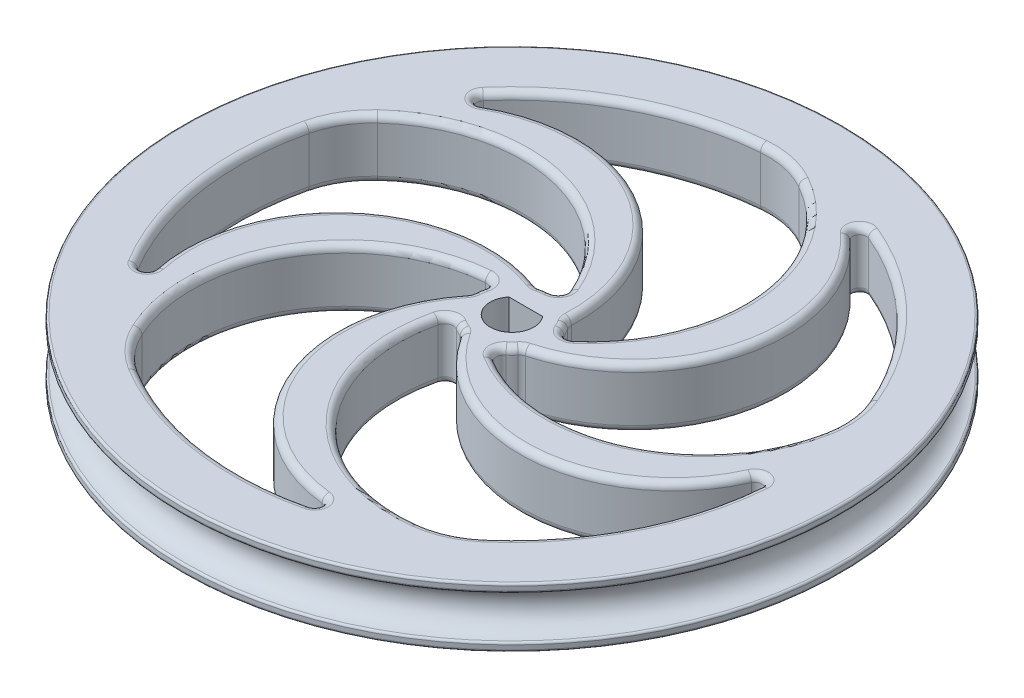
from build123d import *

# Parameters (mm, degrees)
LIP_BEVEL_R                   = 0.15875
SPOKES_DEPTH                  = 36.054933753
HUB_FILLET_R                  = 0.635
SPOKES_TO_RIM_OBTUSE_FILLET_R = 6.35
SPOKES_TO_RIM_ACUTE_FILLET_R  = 0.508
HUB_FACE_FILLET_R             = 0.508
AXLE_CUT_DEPTH                = 36.054933765


with BuildPart() as part:
    # Sketch1 → rim revolve (revolve)
    with BuildSketch(Plane.XY):
        with BuildLine():
            Line((24.5875, 4.445), (24.5875, 3.81))
            ThreePointArc((24.5875, 3.81), (23, 2.2225), (24.5875, 0.635))
            Line((24.5875, 0.635), (24.5875, 0))
            Line((24.5875, 0), (0, 0))
            Line((0, 0), (0, 4.445))
            Line((0, 4.445), (24.5875, 4.445))
        make_face()
    revolve(axis=Axis((0, 0, 0), (0, 1, 0)))

    # lip bevel
    lip_bevel_edges = [part.edges().sort_by_distance(p)[0] for p in [
        (-24.5875, 0, 0),
        (-24.5875, 0.635, 0),
        (-24.5875, 3.81, 0),
        (-24.5875, 4.445, 0),
    ]]
    fillet(lip_bevel_edges, radius=LIP_BEVEL_R)

    # Sketch3 → spokes (cut, through all)
    with BuildSketch(Plane(origin=(0, 4.445, 0), x_dir=(1, 0, 0), z_dir=(0, 1, 0))):
        with BuildLine():
            ThreePointArc((11.943796327, -16.439225326), (18.563243699, -8.264888587), (20.208684914, 2.124018374))
            ThreePointArc((20.208684914, 2.124018374), (11.454554701, -7.926654067), (-0.877115114, -2.868914268))
            ThreePointArc((-0.877115114, -2.868914268), (-1.668625791, -2.493128149), (-2.31780188, -1.904676992))
            ThreePointArc((-2.31780188, -1.904676992), (0.372519159, -13.5290397), (11.943796327, -16.439225326))
        make_face()
        with BuildLine():
            ThreePointArc((1.095215294, -2.792938141), (12.981996117, -3.826416412), (19.325468411, 6.279225326))
            ThreePointArc((19.325468411, 6.279225326), (13.596733921, 15.100702854), (4.224765557, 19.875959247))
            ThreePointArc((4.224765557, 19.875959247), (11.078348069, 8.444458074), (2.457456133, -1.720729309))
            ThreePointArc((2.457456133, -1.720729309), (1.855472046, -2.357376399), (1.095215294, -2.792938141))
        make_face()
        with BuildLine():
            ThreePointArc((-11.943796327, -16.439225326), (-2.124018374, -20.208684914), (8.264888587, -18.563243699))
            ThreePointArc((8.264888587, -18.563243699), (-3.999043938, -13.343399705), (-2.999543085, -0.052357219))
            ThreePointArc((-2.999543085, -0.052357219), (-2.886739499, 0.816538465), (-2.527695635, 1.615783022))
            ThreePointArc((-2.527695635, 1.615783022), (-12.751766616, -4.534989958), (-11.943796327, -16.439225326))
        make_face()
        with BuildLine():
            ThreePointArc((2.994682157, 0.178546292), (7.650795684, 11.164184303), (0, 20.32))
            ThreePointArc((0, 20.32), (-10.16, 17.597636205), (-17.597636205, 10.16))
            ThreePointArc((-17.597636205, 10.16), (-4.607759055, 13.145616174), (2.39590653, 1.805445069))
            ThreePointArc((2.39590653, 1.805445069), (2.815370581, 1.03618941), (2.994682157, 0.178546292))
        make_face()
        with BuildLine():
            ThreePointArc((-19.325468411, 6.279225326), (-19.875959247, -4.224765557), (-15.100702854, -13.596733921))
            ThreePointArc((-15.100702854, -13.596733921), (-13.926099777, -0.320020476), (-0.976704463, 2.836555727))
            ThreePointArc((-0.976704463, 2.836555727), (-0.115477336, 2.997776674), (0.755600065, 2.903285818))
            ThreePointArc((0.755600065, 2.903285818), (-8.253544344, 10.726261768), (-19.325468411, 6.279225326))
        make_face()
    extrude(amount=-SPOKES_DEPTH, mode=Mode.SUBTRACT)

    # hub fillet
    hub_fillet_edges = [part.edges().sort_by_distance(p)[0] for p in [
        (2.994682157, 2.2225, -0.178546292),
        (0.755600065, 2.2225, -2.903285818),
        (-0.976704463, 2.2225, -2.836555727),
        (-2.527695635, 2.2225, -1.615783022),
        (-2.999543085, 2.2225, 0.052357219),
        (-0.877115114, 2.2225, 2.868914268),
        (-2.31780188, 2.2225, 1.904676992),
        (1.095215294, 2.2225, 2.792938141),
        (2.457456133, 2.2225, 1.720729309),
        (2.39590653, 2.2225, -1.805445069),
    ]]
    fillet(hub_fillet_edges, radius=HUB_FILLET_R)

    # spokes to rim obtuse fillet
    spokes_to_rim_obtuse_fillet_edges = [part.edges().sort_by_distance(p)[0] for p in [
        (0, 2.2225, -20.32),
        (19.325468411, 2.2225, -6.279225326),
        (11.943796327, 2.2225, 16.439225326),
        (-11.943796327, 2.2225, 16.439225326),
        (-19.325468411, 2.2225, -6.279225326),
    ]]
    fillet(spokes_to_rim_obtuse_fillet_edges, radius=SPOKES_TO_RIM_OBTUSE_FILLET_R)

    # spokes to rim acute fillet
    spokes_to_rim_acute_fillet_edges = [part.edges().sort_by_distance(p)[0] for p in [
        (-15.100702854, 2.2225, 13.596733921),
        (8.264888587, 2.2225, 18.563243699),
        (20.208684914, 2.2225, -2.124018374),
        (4.224765557, 2.2225, -19.875959247),
        (-17.597636205, 2.2225, -10.16),
    ]]
    fillet(spokes_to_rim_acute_fillet_edges, radius=SPOKES_TO_RIM_ACUTE_FILLET_R)

    # hub face fillet
    hub_face_fillet_edges = [part.edges().sort_by_distance(p)[0] for p in [
        (-16.744714107, 4.445, 10.758173584),
        (-12.700118087, 4.445, -0.905031214),
        (-0.982438695, 4.445, -2.874179937),
        (-0.472592407, 4.445, -2.962542222),
        (0.350018618, 4.445, -3.292517021),
        (-7.719603677, 4.445, -10.623396182),
        (-19.08661236, 4.445, -6.386354103),
        (-20.067259756, 4.445, 3.194915631),
        (19.870254053, 4.445, 1.138750748),
        (9.742647363, 4.445, 8.197127746),
        (-0.894590979, 4.445, 2.90272339),
        (-1.359003339, 4.445, 2.674529851),
        (-2.218463958, 4.445, 2.457966443),
        (0.001014959, 4.445, 13.131977244),
        (11.687589007, 4.445, 16.385498263),
        (18.112678463, 4.445, 9.210498297),
        (-15.406032316, 4.445, -12.600710999),
        (-3.063816486, 4.445, -12.35820009),
        (2.429917305, 4.445, -1.822525168),
        (2.671506, 4.445, -1.364937981),
        (3.239531469, 4.445, -0.684556227),
        (7.717961438, 4.445, -10.624589338),
        (0.175696101, 4.445, -20.125939009),
        (-9.239669625, 4.445, -18.097814929),
        (7.223262504, 4.445, -18.545841264),
        (10.806575363, 4.445, -6.732756482),
        (2.484210179, 4.445, 1.747797437),
        (2.123673916, 4.445, 2.118964157),
        (1.652121938, 4.445, 2.869438006),
        (12.489566169, 4.445, 4.057038855),
        (19.195198522, 4.445, -6.05216026),
        (14.356829883, 4.445, -14.379980379),
        (5.057229866, 4.445, 19.249627931),
        (-4.785288153, 4.445, 11.798860039),
        (-3.03709781, 4.445, 0.046184277),
        (-2.96358417, 4.445, -0.466013805),
        (-3.023208067, 4.445, -1.350331201),
        (-12.48893889, 4.445, 4.058969421),
        (-11.971871269, 4.445, 16.178955109),
        (-3.162578965, 4.445, 20.072381381),
        (-0.982438695, 0, -2.874179937),
        (-12.700118087, 0, -0.905031214),
        (-16.744714107, 0, 10.758173584),
        (-20.067259756, 0, 3.194915631),
        (-19.08661236, 0, -6.386354103),
        (-7.719603677, 0, -10.623396182),
        (0.350018618, 0, -3.292517021),
        (-0.472592407, 0, -2.962542222),
        (-0.894590979, 0, 2.90272339),
        (9.742647363, 0, 8.197127746),
        (19.870254053, 0, 1.138750748),
        (18.112678463, 0, 9.210498297),
        (11.687589007, 0, 16.385498263),
        (0.001014959, 0, 13.131977244),
        (-2.218463958, 0, 2.457966443),
        (-1.359003339, 0, 2.674529851),
        (3.239531469, 0, -0.684556227),
        (2.671506, 0, -1.364937981),
        (2.429917305, 0, -1.822525168),
        (-3.063816486, 0, -12.35820009),
        (-15.406032316, 0, -12.600710999),
        (-9.239669625, 0, -18.097814929),
        (0.175696101, 0, -20.125939009),
        (7.717961438, 0, -10.624589338),
        (2.484210179, 0, 1.747797437),
        (10.806575363, 0, -6.732756482),
        (7.223262504, 0, -18.545841264),
        (14.356829883, 0, -14.379980379),
        (19.195198522, 0, -6.05216026),
        (12.489566169, 0, 4.057038855),
        (1.652121938, 0, 2.869438006),
        (2.123673916, 0, 2.118964157),
        (-3.03709781, 0, 0.046184277),
        (-4.785288153, 0, 11.798860039),
        (5.057229866, 0, 19.249627931),
        (-3.162578965, 0, 20.072381381),
        (-11.971871269, 0, 16.178955109),
        (-12.48893889, 0, 4.058969421),
        (-3.023208067, 0, -1.350331201),
        (-2.96358417, 0, -0.466013805),
    ]]
    fillet(hub_face_fillet_edges, radius=HUB_FACE_FILLET_R)

    # Sketch2 → axle cut (cut, through all)
    with BuildSketch(Plane(origin=(0, 4.445, 0), x_dir=(1, 0, 0), z_dir=(0, 1, 0))):
        with BuildLine():
            Line((1.260952021, 1.025), (-1.260952021, 1.025))
            ThreePointArc((-1.260952021, 1.025), (-0.543864857, -1.53128574), (1.625, 0))
            ThreePointArc((1.625, 0), (1.53128574, 0.543864857), (1.260952021, 1.025))
        make_face()
    extrude(amount=-AXLE_CUT_DEPTH, mode=Mode.SUBTRACT)


solid = part.part
